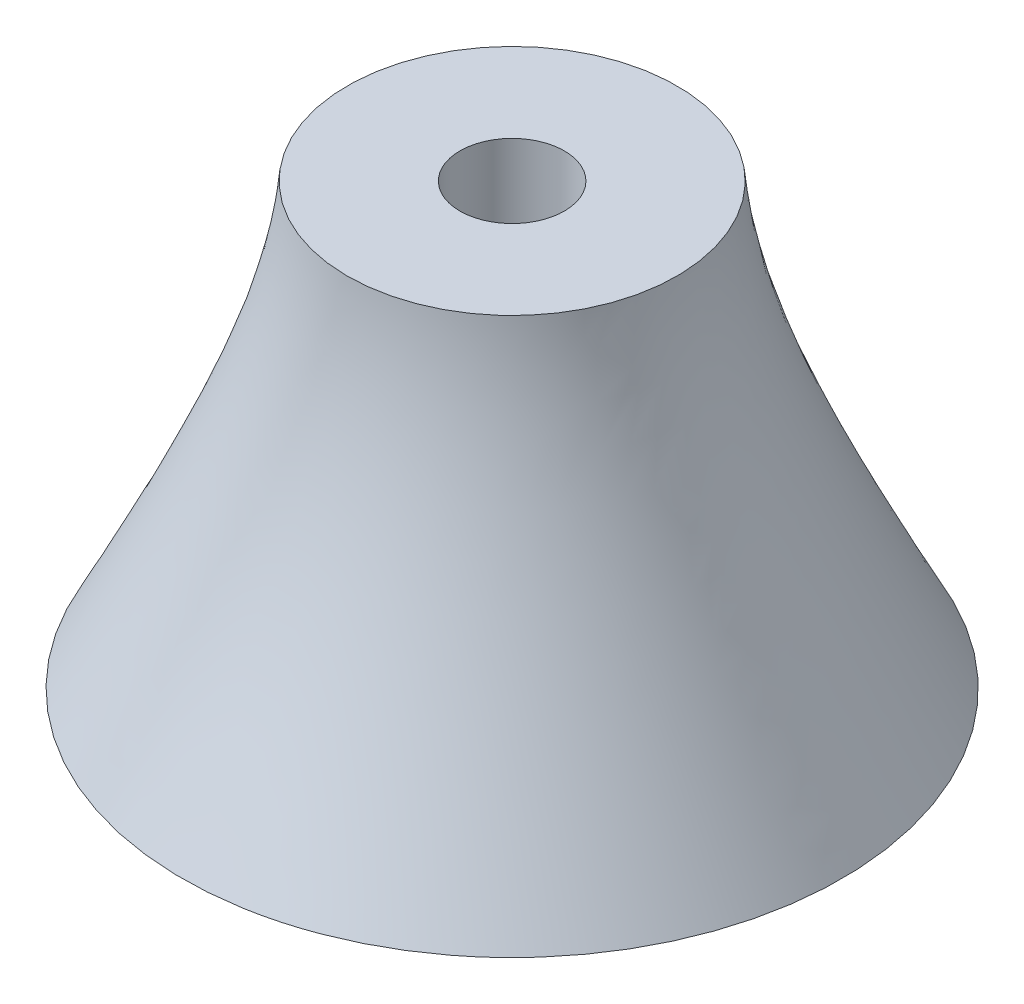
from build123d import *

# Parameters (mm, degrees)
IZIM4_R               = 4.75
KES_EKSTR_ZYON1_DEPTH = 60


with BuildPart() as part:
    # Loft1: read off the stored shape, not the designer's step
    # Loft1: loft between two sections, ruled curve by curve
    loft1_from = [
        Edge.make_bspline([(-14.80637369, 40, -2.402352629), (-10.001668433, 40, -32.015100009), (19.611078947, 40, -27.210394751), (14.80637369, 40, 2.402352629), (10.001668433, 40, 32.015100009), (-19.611078947, 40, 27.210394751), (-14.80637369, 40, -2.402352629)], [0, 0, 0, 0, 0.5, 0.5, 0.5, 1, 1, 1, 1], 3, [1, 0.333333333, 0.333333333, 1, 0.333333333, 0.333333333, 1]),
    ]
    loft1_to = [
        Edge.make_bspline([(-14.601040278, 0, -26.207052921), (37.813065564, 0, -55.409133477), (67.01514612, 0, -2.995027635), (14.601040278, 0, 26.207052921), (-37.813065564, 0, 55.409133477), (-67.01514612, 0, 2.995027635), (-14.601040278, 0, -26.207052921)], [0, 0, 0, 0, 0.5, 0.5, 0.5, 1, 1, 1, 1], 3, [1, 0.333333333, 0.333333333, 1, 0.333333333, 0.333333333, 1]),
    ]
    loft1 = Solid(Shell([*[Face.make_surface_from_curves(loft1_from[k], loft1_to[k]) for k in range(1)], Face(Wire(loft1_from)), Face(Wire(loft1_to))]))
    add(loft1)

    # Çizim4 → Kes-Ekstrüzyon1 (cut)
    with BuildSketch(Plane(origin=(0, 40, 0), x_dir=(1, 0, 0), z_dir=(0, 1, 0))):
        with Locations(Location((0, 0, 0), (0, 0, 270))):
            Circle(IZIM4_R)
    extrude(amount=-KES_EKSTR_ZYON1_DEPTH, mode=Mode.SUBTRACT)


solid = part.part
